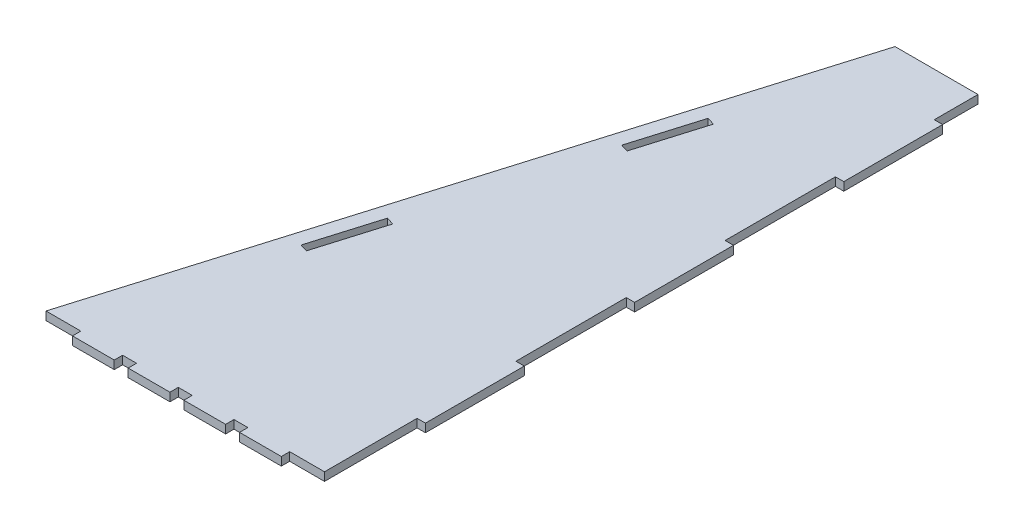
from build123d import *

# Parameters (mm, degrees)
BOSS_EXTRUDE1_DEPTH   = 6
SKETCH2_W             = 71
SKETCH2_H             = 6
BOSS_EXTRUDE2_DEPTH   = 6
CUT_EXTRUDE1_DEPTH    = 6
SKETCH5_W             = 30
SKETCH5_H             = 6
BOSS_EXTRUDE3_DEPTH   = 6
BOSS_EXTRUDE3_2_DEPTH = 6
BOSS_EXTRUDE3_3_DEPTH = 6
BOSS_EXTRUDE3_4_DEPTH = 6


with BuildPart() as part:
    # Sketch1 → Boss-Extrude1 (new body)
    with BuildSketch(Plane(origin=(0, 0, 0), x_dir=(1, 0, 0), z_dir=(0, 1, 0))):
        Polygon((200, 469.3), (140.436469322, 469.3), (0, 0), (200, 0), align=None)
    extrude(amount=BOSS_EXTRUDE1_DEPTH)

    # Sketch2 → Boss-Extrude2 (add)
    with BuildSketch(Plane(origin=(200, 0, 0), x_dir=(0, 0, -1), z_dir=(1, 0, 0))):
        with Locations((402.4, 3)):
            Rectangle(SKETCH2_W, SKETCH2_H)
        with Locations((252.2, 3)):
            Rectangle(SKETCH2_W, SKETCH2_H)
        with Locations((102, 3)):
            Rectangle(SKETCH2_W, SKETCH2_H)
    extrude(amount=BOSS_EXTRUDE2_DEPTH)

    # Sketch4 → Cut-Extrude1 (cut)
    with BuildSketch(Plane(origin=(0, 6, 0), x_dir=(1, 0, 0), z_dir=(0, 1, 0))):
        Polygon((123.445854535, 355.88111854), (117.889311346, 357.54389567), (103.612362884, 309.834266216), (109.168906073, 308.171489086), align=None)
        Polygon((56.132049338, 130.936921838), (50.575506148, 132.599698968), (64.85245461, 180.309328422), (70.4089978, 178.646551292), align=None)
    extrude(amount=-CUT_EXTRUDE1_DEPTH, mode=Mode.SUBTRACT)


with BuildPart() as body_2:
    # Sketch5 → Boss-Extrude3 (new body)
    with BuildSketch(Plane.XZ):
        with Locations((160, 3)):
            Rectangle(SKETCH5_W, SKETCH5_H)
    extrude(amount=-BOSS_EXTRUDE3_DEPTH)


with BuildPart() as body_3:
    # Sketch5 → Boss-Extrude3 2 (new body)
    with BuildSketch(Plane.XZ):
        with Locations((120, 3)):
            Rectangle(SKETCH5_W, SKETCH5_H)
    extrude(amount=-BOSS_EXTRUDE3_2_DEPTH)


with BuildPart() as body_4:
    # Sketch5 → Boss-Extrude3 3 (new body)
    with BuildSketch(Plane.XZ):
        with Locations((80, 3)):
            Rectangle(SKETCH5_W, SKETCH5_H)
    extrude(amount=-BOSS_EXTRUDE3_3_DEPTH)


with BuildPart() as body_5:
    # Sketch5 → Boss-Extrude3 4 (new body)
    with BuildSketch(Plane.XZ):
        with Locations((40, 3)):
            Rectangle(SKETCH5_W, SKETCH5_H)
    extrude(amount=-BOSS_EXTRUDE3_4_DEPTH)


with BuildPart() as body_3_1:
    add(body_3.part)

    # Combine1: union body 2, body 4, body 5, part
    add(body_2.part)
    add(body_4.part)
    add(body_5.part)
    add(part.part)


solid = body_3_1.part
